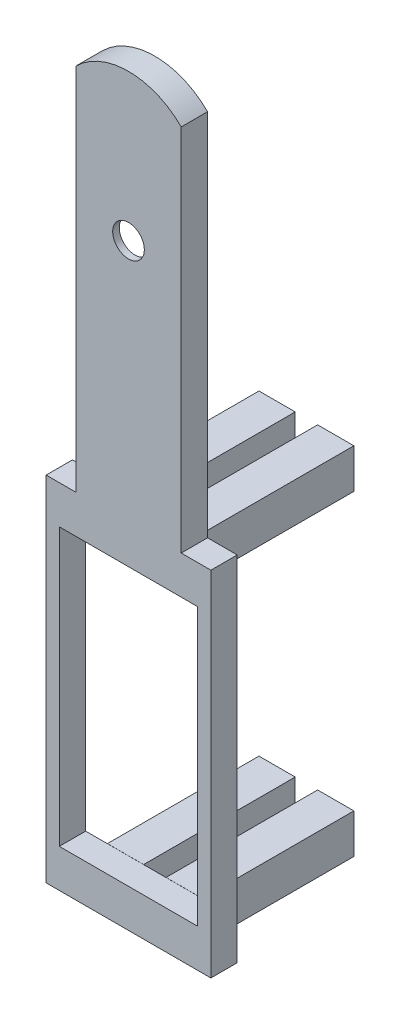
from build123d import *

# Parameters (mm, degrees)
EXTRUDE_1_DEPTH          = 4
CUT_EXTRUDE_2_DEPTH      = 3
CUT_EXTRUDE_5_DEPTH      = 4
CUT_EXTRUDE_5_DEPTH_BACK = 2
SKETCH_5_R               = 2.4
SKETCH_2_W               = 21
SKETCH_2_H               = 42
CUT_EXTRUDE_6_DEPTH      = 4
SKETCH_6_W               = 5.5
SKETCH_6_H               = 6
EXTRUDE_2_DEPTH          = 23
SKETCH_3_R               = 1.25
CUT_EXTRUDE_7_DEPTH      = 23


with BuildPart() as part:
    # 草圖1 → 填料-伸長1 (new body)
    with BuildSketch(Plane.XY):
        with BuildLine():
            Line((-12.5, 26.8), (-12.5, -26.8))
            Line((-12.5, -26.8), (12.5, -26.8))
            Line((12.5, -26.8), (12.5, 26.8))
            Line((12.5, 26.8), (8, 26.8))
            Line((8, 26.8), (8, 82.8))
            ThreePointArc((8, 82.8), (0, 86.113708499), (-8, 82.8))
            Line((-8, 82.8), (-8, 26.8))
            Line((-8, 26.8), (-12.5, 26.8))
        make_face()
    extrude(amount=EXTRUDE_1_DEPTH)

    # 草圖4 → 除料-伸長2 (cut)
    with BuildSketch(Plane.XY):
        with BuildLine():
            Line((-2.6, 81.8), (-5, 68.00724828))
            ThreePointArc((-5, 68.00724828), (-6.469116128, 64.4868159), (-5.710139073, 60.748407125))
            Line((-5.710139073, 60.748407125), (-2.6, 47.098241011))
            ThreePointArc((-2.6, 47.098241011), (0, 44.498241011), (2.6, 47.098241011))
            Line((2.6, 47.098241011), (5.710139073, 60.748407125))
            ThreePointArc((5.710139073, 60.748407125), (6.469116128, 64.4868159), (5, 68.00724828))
            Line((5, 68.00724828), (2.6, 81.8))
            ThreePointArc((2.6, 81.8), (0, 84.4), (-2.6, 81.8))
        make_face()
    extrude(amount=CUT_EXTRUDE_2_DEPTH, mode=Mode.SUBTRACT)

    # 草圖5 → 除料-伸長5 (cut, two sides: drawn at the far end of the back side and taken through both)
    with BuildSketch(Plane.XY.offset(-CUT_EXTRUDE_5_DEPTH_BACK)):
        with Locations((0, 63.853936349)):
            Circle(SKETCH_5_R)
    extrude(amount=CUT_EXTRUDE_5_DEPTH + CUT_EXTRUDE_5_DEPTH_BACK, mode=Mode.SUBTRACT)

    # 草圖2 → 除料-伸長6 (cut)
    with BuildSketch(Plane.XY):
        Rectangle(SKETCH_2_W, SKETCH_2_H)
    extrude(amount=CUT_EXTRUDE_6_DEPTH, mode=Mode.SUBTRACT)

    # 草圖6 → 填料-伸長2 (add)
    with BuildSketch(Plane.XY):
        with Locations((-4.45, 24)):
            Rectangle(SKETCH_6_W, SKETCH_6_H)
        with Locations((4.45, -23.985077759)):
            Rectangle(SKETCH_6_W, SKETCH_6_H)
        with Locations((-4.45, -23.985077759)):
            Rectangle(SKETCH_6_W, SKETCH_6_H)
        with Locations((4.45, 24)):
            Rectangle(SKETCH_6_W, SKETCH_6_H)
    extrude(amount=-EXTRUDE_2_DEPTH)

    # 草圖3 → 除料-伸長7 (cut)
    with BuildSketch(Plane.XY):
        with Locations((-4.7, 23.81)):
            Circle(SKETCH_3_R)
        with Locations((4.7, 23.81)):
            Circle(SKETCH_3_R)
        with Locations((4.7, -23.81)):
            Circle(SKETCH_3_R)
        with Locations((-4.7, -23.81)):
            Circle(SKETCH_3_R)
    extrude(amount=-CUT_EXTRUDE_7_DEPTH, mode=Mode.SUBTRACT)


solid = part.part
